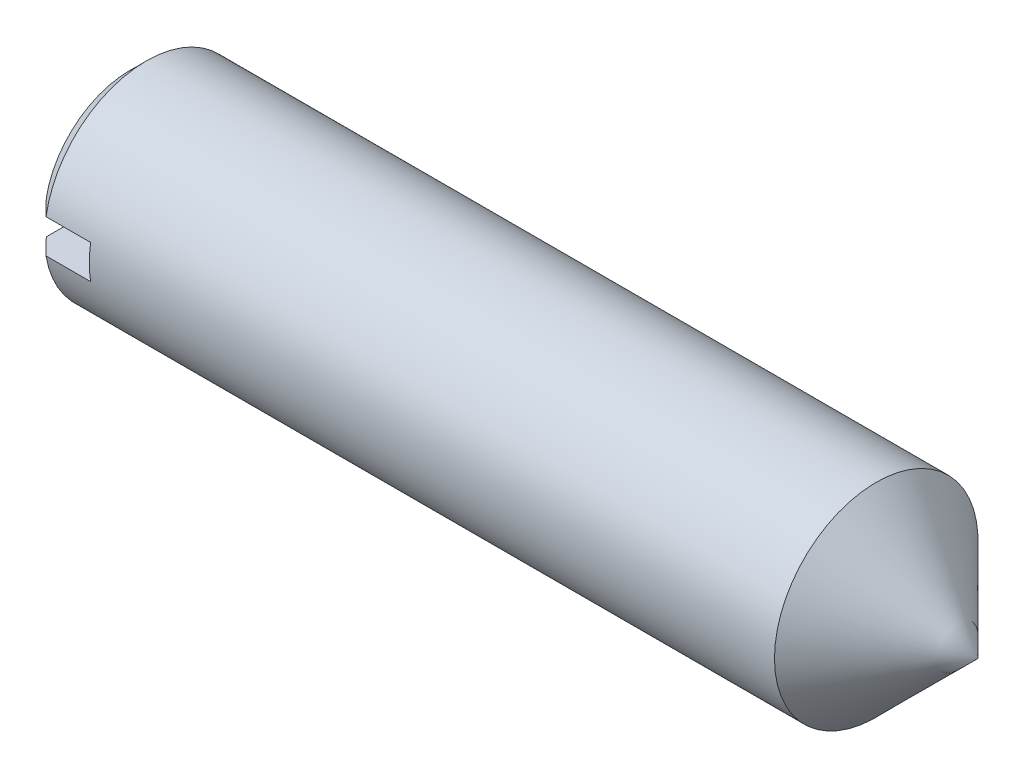
from build123d import *

# Parameters (mm, degrees)
SLOTSKE_W  = 12
SLOTSKE_H  = 2
SLOT_DEPTH = 3.6


with BuildPart() as part:
    # BodySke → BaseBody (revolve)
    with BuildSketch(Plane.XY):
        Polygon((0, 0), (0, 5.036), (0.964, 6), (44, 6), (50, 0), align=None)
    revolve(axis=Axis((0, 0, 0), (1, 0, 0)))

    # SlotSke → Slot (cut)
    with BuildSketch(Plane(origin=(0, 0, 0), x_dir=(0, 0, -1), z_dir=(1, 0, 0))):
        Rectangle(SLOTSKE_W, SLOTSKE_H)
    extrude(amount=SLOT_DEPTH, mode=Mode.SUBTRACT)


solid = part.part
